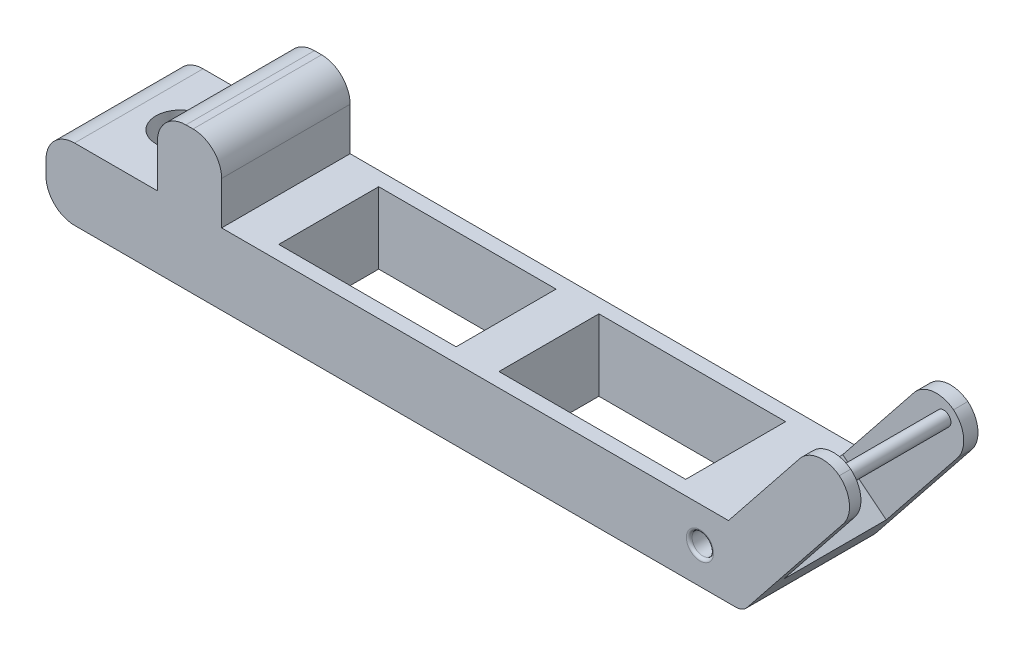
from build123d import *

# Parameters (mm, degrees)
SZKIC1_R                    = 0.75
DODANIE_WYCI_GNI_CIE1_DEPTH = 9
ZAOKR_GLENIE1_R             = 2
ZAOKR_GLENIE3_R             = 1
SZKIC2_R                    = 1.7
WYTNIJ_WYCI_GNI_CIE1_DEPTH  = 27647.561311418
SZKIC3_W                    = 13.077407628
SZKIC3_H                    = 7
SZKIC3_W_2                  = 12.422592372
WYTNIJ_WYCI_GNI_CIE2_DEPTH  = 27647.561311418
SZKIC4_W                    = 7.2
SZKIC4_H                    = 12.770373744
WYTNIJ_WYCI_GNI_CIE3_DEPTH  = 17269.61853488
ZAOKR_GLENIE4_R             = 2
ZAOKR_GLENIE5_R             = 1
ZAOKR_GLENIE7_R             = 0.2
DODANIE_WYCI_GNI_CIE3_DEPTH = 7.2


with BuildPart() as part:
    # Szkic1 → Dodanie-wyciągnięcie1 (new body)
    with BuildSketch(Plane.XY):
        Polygon((-27646.558741393, -28.902320952), (-27646.558741393, -33.902320952), (-27597.758741393, -33.902320952), (-27589.47352106, -23.517649804), (-27592.522131216, -21.085371835), (-27598.758741393, -28.902320952), (-27634.258741393, -28.902320952), (-27634.258741393, -23.902320952), (-27638.758741393, -23.902320952), (-27638.758741393, -28.902320952), align=None)
        with Locations((-27600.758741393, -31.402320952)):
            Circle(SZKIC1_R, mode=Mode.SUBTRACT)
    extrude(amount=DODANIE_WYCI_GNI_CIE1_DEPTH)

    # Zaokrąglenie1
    zaokr_glenie1_edges = [part.edges().sort_by_distance(p)[0] for p in [
        (-27638.758741393, -23.902320952, 4.5),
        (-27634.258741393, -23.902320952, 4.5),
        (-27646.558741393, -33.902320952, 4.5),
        (-27646.558741393, -28.902320952, 4.5),
    ]]
    fillet(zaokr_glenie1_edges, radius=ZAOKR_GLENIE1_R)

    # Zaokrąglenie3
    zaokr_glenie3_edges = [part.edges().sort_by_distance(p)[0] for p in [
        (-27597.758741393, -33.902320952, 4.5),
    ]]
    fillet(zaokr_glenie3_edges, radius=ZAOKR_GLENIE3_R)

    # Szkic2 → Wytnij-wyciągnięcie1 (cut, through all)
    with BuildSketch(Plane(origin=(0, -28.902320952, 0), x_dir=(1, 0, 0), z_dir=(0, 1, 0))):
        with Locations(Location((-27641.658741393, -4.5, 0), (0, 0, 180))):
            Circle(SZKIC2_R)
    extrude(amount=-WYTNIJ_WYCI_GNI_CIE1_DEPTH, mode=Mode.SUBTRACT)

    # Szkic3 → Wytnij-wyciągnięcie2 (cut, through all)
    with BuildSketch(Plane(origin=(0, -28.902320952, 0), x_dir=(1, 0, 0), z_dir=(0, 1, 0))):
        with Locations((-27609.297445207, -4.5)):
            Rectangle(SZKIC3_W, SZKIC3_H)
        with Locations((-27625.047445207, -4.5)):
            Rectangle(SZKIC3_W_2, SZKIC3_H)
    extrude(amount=-WYTNIJ_WYCI_GNI_CIE2_DEPTH, mode=Mode.SUBTRACT)

    # Szkic4 → Wytnij-wyciągnięcie3 (cut, through all)
    with BuildSketch(Plane(origin=(-16850.04669364, 13443.502203136, 0), x_dir=(0, 0, 1), z_dir=(-0.7816949117558672, 0.6236610176490005, 0))):
        with Locations((4.6, -17228.477572842)):
            Rectangle(SZKIC4_W, SZKIC4_H)
    extrude(amount=-WYTNIJ_WYCI_GNI_CIE3_DEPTH, mode=Mode.SUBTRACT)

    # Zaokrąglenie4
    # the kernel refuses this fillet: 2 mm, written as the material it takes off along each edge
    with BuildSketch(Plane(origin=(-27589.47352106, -23.517649804, -5), x_dir=(-0.6236610176488676, -0.7816949117559733, 0), z_dir=(0, 0, 1)), Plane(origin=(-27592.522131216, -21.085371835, -5), x_dir=(0.78169491175572, -0.623661017649185, 0), z_dir=(0, 0, 1))) as zaokr_glenie4_piece_1:
        with BuildLine():
            CenterArc((ZAOKR_GLENIE4_R, -ZAOKR_GLENIE4_R), ZAOKR_GLENIE4_R, 90, 90)
            Line((0, -ZAOKR_GLENIE4_R), (0, 0))
            Line((0, 0), (ZAOKR_GLENIE4_R, 0))
        make_face()
    extrude(amount=11, mode=Mode.SUBTRACT)
    with BuildSketch(Plane(origin=(-27589.47352106, -23.517649804, 3.2), x_dir=(-0.6236610176488676, -0.7816949117559733, 0), z_dir=(0, 0, 1)), Plane(origin=(-27592.522131216, -21.085371835, 3.2), x_dir=(0.78169491175572, -0.623661017649185, 0), z_dir=(0, 0, 1))) as zaokr_glenie4_piece_2:
        with BuildLine():
            CenterArc((ZAOKR_GLENIE4_R, -ZAOKR_GLENIE4_R), ZAOKR_GLENIE4_R, 90, 90)
            Line((0, -ZAOKR_GLENIE4_R), (0, 0))
            Line((0, 0), (ZAOKR_GLENIE4_R, 0))
        make_face()
    extrude(amount=10.8, mode=Mode.SUBTRACT)

    # Zaokrąglenie5
    zaokr_glenie5_edges = [part.edges().sort_by_distance(p)[0] for p in [
        (-27639.958741393, -33.902320952, 4.5),
    ]]
    fillet(zaokr_glenie5_edges, radius=ZAOKR_GLENIE5_R)

    # Zaokrąglenie7
    zaokr_glenie7_edges = [part.edges().sort_by_distance(p)[0] for p in [
        (-27601.508741393, -31.402320952, 0),
        (-27601.508741393, -31.402320952, 9),
    ]]
    fillet(zaokr_glenie7_edges, radius=ZAOKR_GLENIE7_R)

    # Szkic6 → Dodanie-wyciągnięcie3 (add)
    with BuildSketch(Plane.XY.offset(1)):
        with BuildLine():
            ThreePointArc((-27591.372412611, -22.771016391), (-27592.075090576, -22.850033338), (-27591.996073629, -23.552711303))
            Line((-27591.996073629, -23.552711303), (-27591.372412611, -22.771016391))
        make_face()
        with BuildLine():
            Line((-27591.372412611, -22.771016391), (-27591.996073629, -23.552711303))
            ThreePointArc((-27591.996073629, -23.552711303), (-27591.467350583, -23.612372035), (-27591.18424312, -23.161863847))
            ThreePointArc((-27591.18424312, -23.161863847), (-27591.233734932, -22.944971309), (-27591.372412611, -22.771016391))
        make_face()
    extrude(amount=DODANIE_WYCI_GNI_CIE3_DEPTH)


solid = part.part
